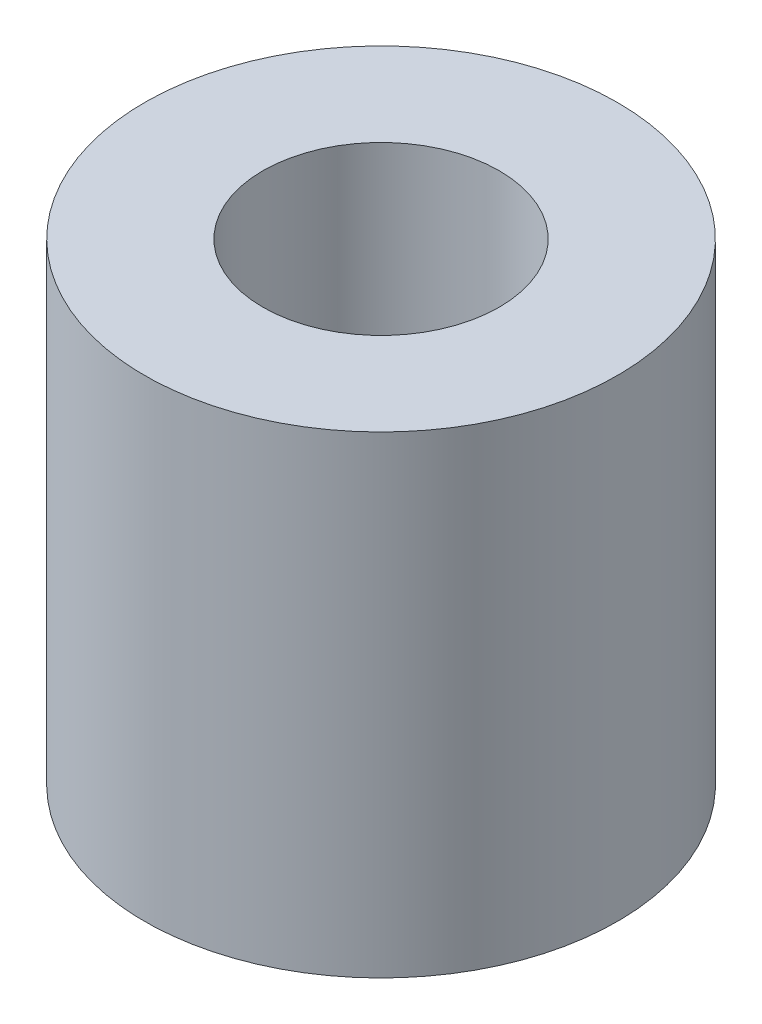
from build123d import *


with BuildPart() as part:
    # Sketch1 → Revolve1 (revolve)
    with BuildSketch(Plane.XY):
        Polygon((2.5, 5), (5, 5), (5, -5), (3.175, -5), (3.175, 0), (2.5, 0), align=None)
    revolve(axis=Axis((0, 0, 0), (0, 1, 0)))


solid = part.part
